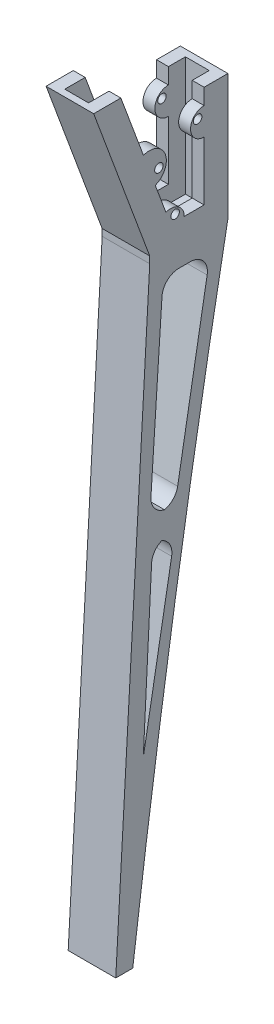
from build123d import *

# Parameters (mm, degrees)
BOSS_EXTRUDE1_DEPTH  = 35
SKETCH6_W            = 14
SKETCH6_H            = 23
BOSS_EXTRUDE6_DEPTH  = 2
BOSS_EXTRUDE8_DEPTH  = 3.5
BOSS_EXTRUDE9_START  = -14
SKETCH14_R           = 1.25
BOSS_EXTRUDE9_DEPTH  = 14
BOSS_EXTRUDE10_DEPTH = 3.5
BOSS_EXTRUDE11_START = -14
SKETCH16_R           = 1.25
BOSS_EXTRUDE11_DEPTH = 14
BOSS_EXTRUDE12_START = -14
SKETCH18_R           = 1.25
BOSS_EXTRUDE12_DEPTH = 14
SKETCH19_W           = 7
SKETCH19_H           = 19
CUT_EXTRUDE5_DEPTH   = 57.095900028
SKETCH20_W           = 7
SKETCH20_H           = 47.4605099
CUT_EXTRUDE6_DEPTH   = 10
BOSS_EXTRUDE13_DEPTH = 14
FILLET1_R            = 5


with BuildPart() as part:
    # Sketch1 → Boss-Extrude1 (new body)
    with BuildSketch(Plane(origin=(0, 0, 0), x_dir=(1, 0, 0), z_dir=(0, 1, 0))):
        Polygon((7, 0), (10.5, 0), (10.5, 7), (-3.5, 7), (-3.5, 0), (0, 0), (0, 5), (7, 5), align=None)
    extrude(amount=BOSS_EXTRUDE1_DEPTH)

    # Sketch6 → Boss-Extrude6 (add)
    with BuildSketch(Plane.XZ):
        with Locations((3.5, 4.5)):
            Rectangle(SKETCH6_W, SKETCH6_H)
    extrude(amount=BOSS_EXTRUDE6_DEPTH)

    # Sweep1: sweep along a path in Sketch8
    with BuildLine(Plane(origin=(10.5, 0, 0), x_dir=(0, 0, -1), z_dir=(1, 0, 0))) as sweep1_path:
        Line((-32.5, 44.5), (-16, 0))
    # Sketch7 → Sweep1 (sweep)
    with BuildSketch(Plane(origin=(0, 0, 0), x_dir=(1, 0, 0), z_dir=(0, 1, 0))):
        Polygon((-3.5, -16), (10.5, -16), (10.5, -8), (7, -8), (7, -14), (0, -14), (0, -8), (-3.5, -8), align=None)
    sweep(path=sweep1_path.line)

    # Sketch13 → Boss-Extrude8 (add)
    with BuildSketch(Plane(origin=(10.5, 0, 0), x_dir=(0, 0, -1), z_dir=(1, 0, 0))):
        Polygon((-8, 0), (0, 0), (0, 5), (-9.853932584, 5), align=None)
    extrude(amount=-BOSS_EXTRUDE8_DEPTH)

    # Sketch14 → Boss-Extrude9 (add)
    with BuildSketch(Plane(origin=(10.5, 0, 0), x_dir=(0, 0, -1), z_dir=(1, 0, 0)).offset(BOSS_EXTRUDE9_START)):
        with BuildLine():
            Line((-9.853932584, 5), (-11.243474968, 8.747553701))
            ThreePointArc((-11.243474968, 8.747553701), (-7.571262705, 8.280915268), (-5.85706046, 5))
            Line((-5.85706046, 5), (-9.853932584, 5))
        make_face()
        with Locations((-8.532023173, 6.9)):
            Circle(SKETCH14_R, mode=Mode.SUBTRACT)
    extrude(amount=BOSS_EXTRUDE9_DEPTH)

    # Sketch15 → Boss-Extrude10 (add)
    with BuildSketch(Plane.ZY.offset(3.5)):
        Polygon((0, 0), (8, 0), (9.853932584, 5), (0, 5), align=None)
    extrude(amount=-BOSS_EXTRUDE10_DEPTH)

    # Sketch16 → Boss-Extrude11 (add)
    with BuildSketch(Plane(origin=(10.5, 0, 0), x_dir=(0, 0, -1), z_dir=(1, 0, 0)).offset(BOSS_EXTRUDE11_START)):
        with BuildLine():
            ThreePointArc((0, 30.317524518), (-4, 26.317524518), (0, 22.317524518))
            Line((0, 22.317524518), (0, 26.317524518))
            Line((0, 26.317524518), (0, 30.317524518))
        make_face()
        with Locations((-1.9, 27.817524518)):
            Circle(SKETCH16_R, mode=Mode.SUBTRACT)
    extrude(amount=BOSS_EXTRUDE11_DEPTH)

    # Sketch18 → Boss-Extrude12 (add)
    with BuildSketch(Plane(origin=(10.5, 0, 0), x_dir=(0, 0, -1), z_dir=(1, 0, 0)).offset(BOSS_EXTRUDE12_START)):
        with BuildLine():
            Line((-17.848966579, 26.562364409), (-14.372392047, 17.186148247))
            ThreePointArc((-14.372392047, 17.186148247), (-11.422571232, 23.612543594), (-17.848966579, 26.562364409))
        make_face()
        with Locations((-13.310679313, 21.074256328)):
            Circle(SKETCH18_R, mode=Mode.SUBTRACT)
    extrude(amount=BOSS_EXTRUDE12_DEPTH)

    # Sketch19 → Cut-Extrude5 (cut, through all)
    with BuildSketch(Plane(origin=(0, 0, 0), x_dir=(1, 0, 0), z_dir=(0, 1, 0))):
        with Locations((3.5, -4.5)):
            Rectangle(SKETCH19_W, SKETCH19_H)
    extrude(amount=CUT_EXTRUDE5_DEPTH, mode=Mode.SUBTRACT)

    # Sketch20 → Cut-Extrude6 (cut)
    with BuildSketch(Plane(origin=(0, -4.563596004, 12.307880133), x_dir=(-1, 0, 0), z_dir=(0, 0.3476574532100169, -0.9376216162330756))):
        with Locations((-3.5, 28.597459295)):
            Rectangle(SKETCH20_W, SKETCH20_H)
    extrude(amount=CUT_EXTRUDE6_DEPTH, mode=Mode.SUBTRACT)

    # Sketch9 → Boss-Extrude13 (add)
    with BuildSketch(Plane(origin=(10.5, 0, 0), x_dir=(0, 0, -1), z_dir=(1, 0, 0))):
        with BuildLine():
            Line((-16, -2), (-26, -179))
            Line((-26, -179), (-21, -179))
            add(Edge.make_bspline(
                [(7, -2), (-9.660155009, -89.83535791), (-21, -179)],
                knots=[0, 0, 0, 0.89649965, 0.89649965, 0.89649965], degree=2))
            Line((7, -2), (-16, -2))
        make_face()
        Polygon((-5.08325747, -7.433503799), (-12.08325747, -7.433503799), (-16, -66.930407946), (-8.514117769, -66.930407946), (1.91674253, -7.433503799), align=None, mode=Mode.SUBTRACT)
        Polygon((-12.215264572, -73.873780488), (-15.215264572, -73.873780488), (-17.9028805, -126.858413083), (-8.514117769, -73.873780488), align=None, mode=Mode.SUBTRACT)
    extrude(amount=-BOSS_EXTRUDE13_DEPTH)

    # Fillet1
    # the kernel refuses this fillet: 5 mm, written as the material it adds along each edge
    with BuildSketch(Plane(origin=(10.5, -73.873780488, 8.514117769), x_dir=(0, 0, 1), z_dir=(-1, 0, 0))) as fillet1_piece_1:
        with BuildLine():
            CenterArc((FILLET1_R * 1.19277604339, -FILLET1_R), FILLET1_R, 90, 100.048385075)
            Line((FILLET1_R * 0.208115283733, -FILLET1_R * 1.17447976499), (0, 0))
            Line((0, 0), (FILLET1_R * 1.19277604339, 0))
        make_face()
    extrude(amount=14)
    with BuildSketch(Plane(origin=(10.5, -73.873780488, 15.215264572), x_dir=(0, 0, -1), z_dir=(-1, 0, 0))) as fillet1_piece_2:
        with BuildLine():
            CenterArc((FILLET1_R * 0.950561215954, FILLET1_R), FILLET1_R, 182.903807688, 87.096192312)
            Line((-FILLET1_R * 0.048154776785, FILLET1_R * 0.949340688451), (0, 0))
            Line((0, 0), (FILLET1_R * 0.950561215954, 0))
        make_face()
    extrude(amount=14)
    with BuildSketch(Plane(origin=(10.5, -66.930407946, 16), x_dir=(0, 0, -1), z_dir=(-1, 0, 0))) as fillet1_piece_3:
        with BuildLine():
            CenterArc((FILLET1_R * 1.06799555055, -FILLET1_R), FILLET1_R, 90, 93.766405645)
            Line((FILLET1_R * 0.0701553952566, -FILLET1_R * 1.06568884601), (0, 0))
            Line((0, 0), (FILLET1_R * 1.06799555055, 0))
        make_face()
    extrude(amount=14)
    with BuildSketch(Plane(origin=(10.5, -66.930407946, 8.514117769), x_dir=(0, 0.9849772856062504, -0.17268395073006315), z_dir=(-1, 0, 0))) as fillet1_piece_4:
        with BuildLine():
            CenterArc((FILLET1_R * 0.839934139964, -FILLET1_R), FILLET1_R, 90, 80.056093562)
            Line((-FILLET1_R * 0.145043145642, -FILLET1_R * 0.82731604927), (0, 0))
            Line((0, 0), (FILLET1_R * 0.839934139964, 0))
        make_face()
    extrude(amount=14)
    with BuildSketch(Plane(origin=(10.5, -7.433503799, 12.08325747), x_dir=(0, 0, -1), z_dir=(-1, 0, 0))) as fillet1_piece_5:
        with BuildLine():
            CenterArc((FILLET1_R * 0.936333488925, FILLET1_R), FILLET1_R, 183.766405645, 86.233594355)
            Line((-FILLET1_R * 0.0615066663657, FILLET1_R * 0.934311153992), (0, 0))
            Line((0, 0), (FILLET1_R * 0.936333488925, 0))
        make_face()
    extrude(amount=14)
    with BuildSketch(Plane(origin=(10.5, -7.433503799, -1.91674253), x_dir=(0, 0, 1), z_dir=(-1, 0, 0))) as fillet1_piece_6:
        with BuildLine():
            CenterArc((FILLET1_R * 1.19056953685, -FILLET1_R), FILLET1_R, 90, 99.943906438)
            Line((FILLET1_R * 0.205592251242, -FILLET1_R * 1.17268395073), (0, 0))
            Line((0, 0), (FILLET1_R * 1.19056953685, 0))
        make_face()
    extrude(amount=14)


solid = part.part
